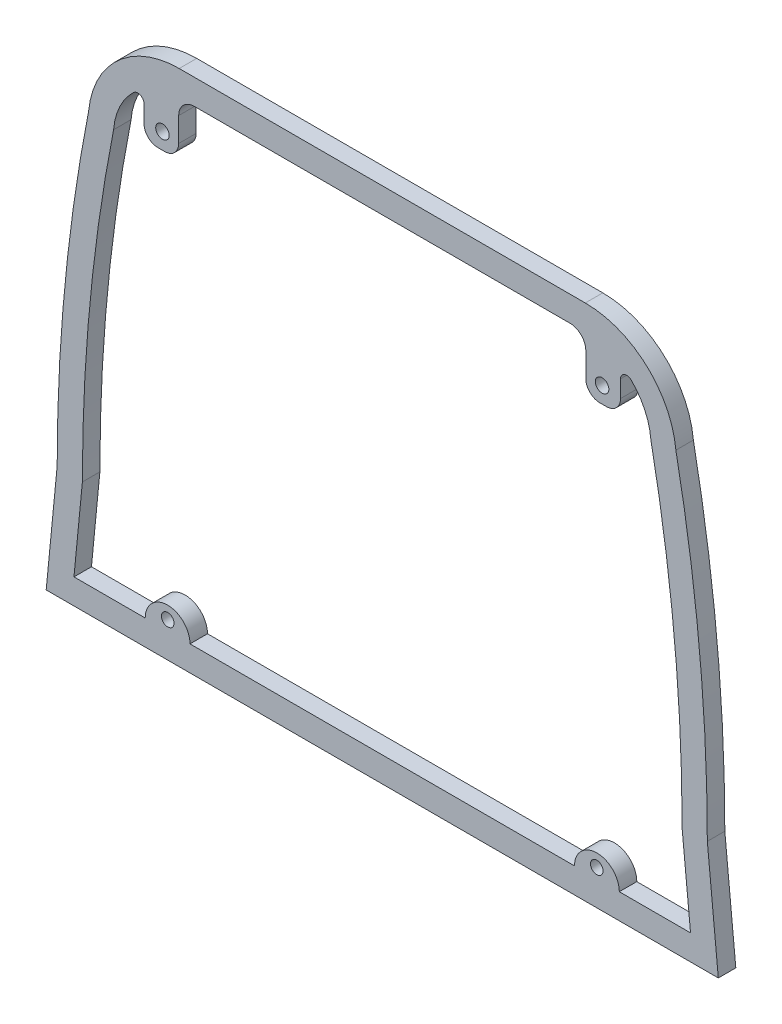
from build123d import *

# Parameters (mm, degrees)
SKETCH1_R           = 0.6096
SKETCH1_R_2         = 0.5715
BOSS_EXTRUDE1_DEPTH = 1.5875


with BuildPart() as part:
    # Sketch1 → Boss-Extrude1 (new body)
    with BuildSketch(Plane.XY):
        with BuildLine():
            Line((30.48, -22.225), (29.483473933, -11.9888))
            ThreePointArc((29.483473933, -11.9888), (28.768713075, 2.729791064), (26.631156966, 17.309868563))
            ThreePointArc((26.631156966, 17.309868563), (23.962166394, 22.62342539), (18.415, 24.765))
            Line((18.415, 24.765), (-18.415, 24.765))
            ThreePointArc((-18.415, 24.765), (-23.962166394, 22.62342539), (-26.631156966, 17.309868563))
            ThreePointArc((-26.631156966, 17.309868563), (-28.768713075, 2.729791064), (-29.483473933, -11.9888))
            Line((-29.483473933, -11.9888), (-30.48, -22.225))
            Line((-30.48, -22.225), (30.48, -22.225))
        make_face()
        with BuildLine():
            Line((-17.030074915, 22.479), (17.030074915, 22.479))
            ThreePointArc((17.030074915, 22.479), (18.043126102, 22.059380459), (18.462745643, 21.046329273))
            Line((18.462745643, 21.046329273), (18.462745643, 18.851715923))
            ThreePointArc((18.462745643, 18.851715923), (18.83472003, 17.953690311), (19.732745643, 17.581715923))
            Line((19.732745643, 17.581715923), (20.340525582, 17.581715923))
            ThreePointArc((20.340525582, 17.581715923), (21.238551194, 17.953690311), (21.610525582, 18.851715923))
            Line((21.610525582, 18.851715923), (21.610525582, 20.403695369))
            ThreePointArc((21.610525582, 20.403695369), (21.951294314, 20.918726173), (22.558568851, 20.806486725))
            ThreePointArc((22.558568851, 20.806486725), (23.811140787, 19.061592759), (24.364966869, 16.986293244))
            ThreePointArc((24.364966869, 16.986293244), (26.493033178, 2.512771258), (27.19743306, -12.099392363))
            Line((27.19743306, -12.099392363), (27.960643369, -19.939))
            Line((27.960643369, -19.939), (21.500635613, -19.939))
            ThreePointArc((21.500635613, -19.939), (19.468635613, -17.907), (17.436635613, -19.939))
            Line((17.436635613, -19.939), (-17.436635613, -19.939))
            ThreePointArc((-17.436635613, -19.939), (-19.468635613, -17.907), (-21.500635613, -19.939))
            Line((-21.500635613, -19.939), (-27.960643369, -19.939))
            Line((-27.960643369, -19.939), (-27.19743306, -12.099392363))
            ThreePointArc((-27.19743306, -12.099392363), (-26.493033178, 2.512771258), (-24.364966869, 16.986293244))
            ThreePointArc((-24.364966869, 16.986293244), (-23.811140787, 19.061592759), (-22.558568851, 20.806486725))
            ThreePointArc((-22.558568851, 20.806486725), (-21.951294314, 20.918726173), (-21.610525582, 20.403695369))
            Line((-21.610525582, 20.403695369), (-21.610525582, 18.851715923))
            ThreePointArc((-21.610525582, 18.851715923), (-21.238551194, 17.953690311), (-20.340525582, 17.581715923))
            Line((-20.340525582, 17.581715923), (-19.732745643, 17.581715923))
            ThreePointArc((-19.732745643, 17.581715923), (-18.83472003, 17.953690311), (-18.462745643, 18.851715923))
            Line((-18.462745643, 18.851715923), (-18.462745643, 21.046329273))
            ThreePointArc((-18.462745643, 21.046329273), (-18.043126102, 22.059380459), (-17.030074915, 22.479))
        make_face(mode=Mode.SUBTRACT)
        with Locations((-19.939, 19.05)):
            Circle(SKETCH1_R, mode=Mode.SUBTRACT)
        with Locations((-19.457528855, -19.05)):
            Circle(SKETCH1_R_2, mode=Mode.SUBTRACT)
        with Locations((19.457528855, -19.05)):
            Circle(SKETCH1_R_2, mode=Mode.SUBTRACT)
        with Locations((19.939, 19.05)):
            Circle(SKETCH1_R, mode=Mode.SUBTRACT)
    extrude(amount=BOSS_EXTRUDE1_DEPTH)


solid = part.part
